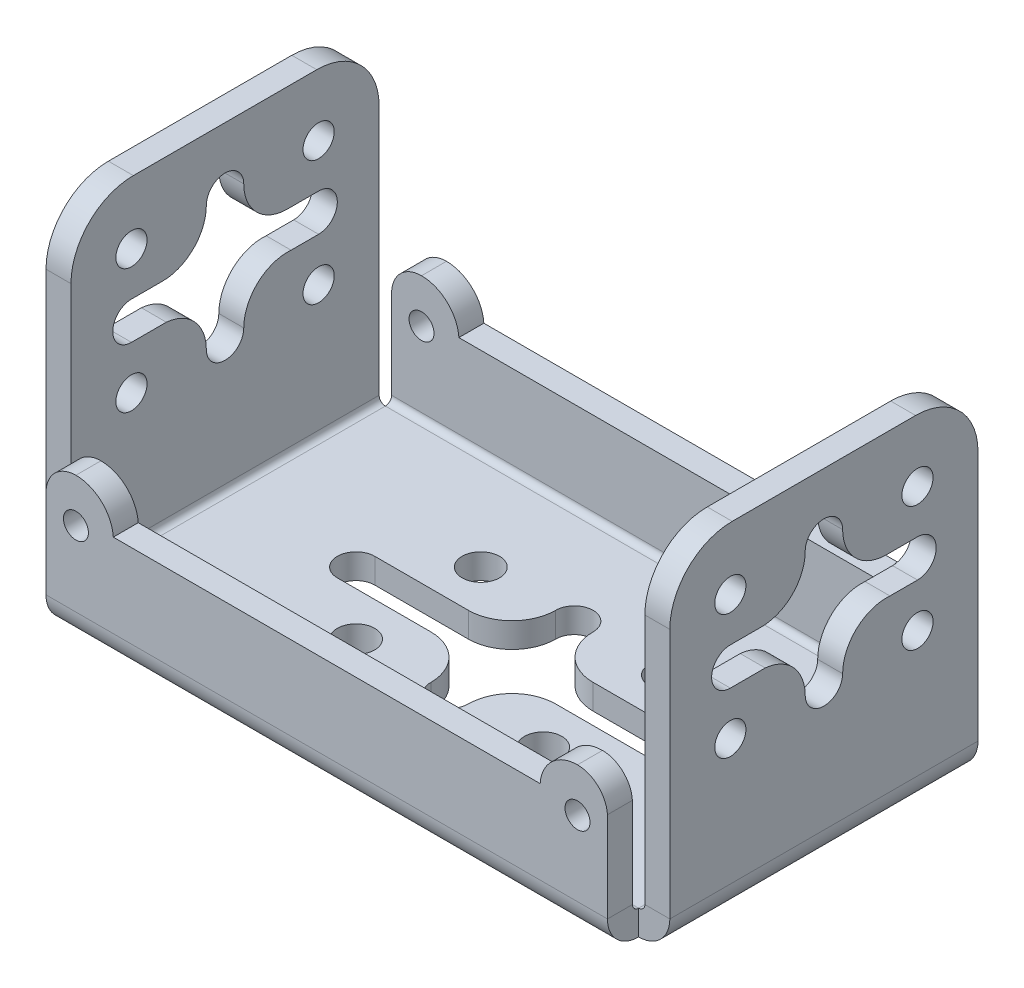
from build123d import *

# Parameters (mm, degrees)
CROQUIS2_W             = 45
CROQUIS2_H             = 24.7
BRIDA_BASE1_DEPTH      = 2
BRIDA_DE_ARISTA1_DEPTH = 24.7
BRIDA_DE_ARISTA2_DEPTH = 24.7
BRIDA_DE_ARISTA3_DEPTH = 45
BRIDA_DE_ARISTA4_DEPTH = 45
CROQUIS34_R            = 1.25
CORTAR_EXTRUIR2_DEPTH  = 59.102345047
REDONDEO2_R            = 5
CROQUIS35_R            = 1
CORTAR_EXTRUIR3_DEPTH  = 47.502150488
CROQUIS36_R            = 1.5
CORTAR_EXTRUIR4_DEPTH  = 10


# Sheet-metal steps are written as plain solids
with BuildPart() as part:
    # Croquis2 → Brida base1 (new body)
    with BuildSketch(Plane(origin=(0, 0, 0), x_dir=(1, 0, 0), z_dir=(0, 1, 0))):
        Rectangle(CROQUIS2_W, CROQUIS2_H)
    extrude(amount=-BRIDA_BASE1_DEPTH)

    # Brida de arista1 section (across the edge) → Brida de arista1 (add)
    with BuildSketch(Plane(origin=(23, 0, 12.35), x_dir=(-1, 0, 0), z_dir=(0, 0, -1))):
        with BuildLine():
            Line((-2, 0.5), (-2, 25.6))
            Line((-2, 25.6), (0, 25.6))
            Line((0, 25.6), (0, 0.5))
            ThreePointArc((0, 0.5), (0.146446609, 0.146446609), (0.5, 0))
            Line((0.5, 0), (0.5, -2))
            ThreePointArc((0.5, -2), (-1.267766953, -1.267766953), (-2, 0.5))
        make_face()
    extrude(amount=BRIDA_DE_ARISTA1_DEPTH)

    # Brida de arista2 section (across the edge) → Brida de arista2 (add)
    with BuildSketch(Plane(origin=(-23, 0, -12.35), x_dir=(1, 0, 0), z_dir=(0, 0, 1))):
        with BuildLine():
            Line((-2, 0.5), (-2, 25.6))
            Line((-2, 25.6), (0, 25.6))
            Line((0, 25.6), (0, 0.5))
            ThreePointArc((0, 0.5), (0.146446609, 0.146446609), (0.5, 0))
            Line((0.5, 0), (0.5, -2))
            ThreePointArc((0.5, -2), (-1.267766953, -1.267766953), (-2, 0.5))
        make_face()
    extrude(amount=BRIDA_DE_ARISTA2_DEPTH)

    # Brida de arista3 section (across the edge) → Brida de arista3 (add)
    with BuildSketch(Plane(origin=(22.5, 0, -12.85), x_dir=(0, 0, 1), z_dir=(-1, 0, 0))):
        with BuildLine():
            Line((-2, 0.5), (-2, 10))
            Line((-2, 10), (0, 10))
            Line((0, 10), (0, 0.5))
            ThreePointArc((0, 0.5), (0.146446609, 0.146446609), (0.5, 0))
            Line((0.5, 0), (0.5, -2))
            ThreePointArc((0.5, -2), (-1.267766953, -1.267766953), (-2, 0.5))
        make_face()
    extrude(amount=BRIDA_DE_ARISTA3_DEPTH)

    # Brida de arista4 section (across the edge) → Brida de arista4 (add)
    with BuildSketch(Plane(origin=(-22.5, 0, 12.85), x_dir=(0, 0, -1), z_dir=(1, 0, 0))):
        with BuildLine():
            Line((-2, 0.5), (-2, 10))
            Line((-2, 10), (0, 10))
            Line((0, 10), (0, 0.5))
            ThreePointArc((0, 0.5), (0.146446609, 0.146446609), (0.5, 0))
            Line((0.5, 0), (0.5, -2))
            ThreePointArc((0.5, -2), (-1.267766953, -1.267766953), (-2, 0.5))
        make_face()
    extrude(amount=BRIDA_DE_ARISTA4_DEPTH)

    # Croquis34 → Cortar-Extruir2 (cut, through all)
    with BuildSketch(Plane.ZY.offset(25)):
        with Locations(Location((-7.5, 20.6, 0), (0, 0, 270))):
            Circle(CROQUIS34_R)
        with Locations(Location((7.5, 20.6, 0), (0, 0, 270))):
            Circle(CROQUIS34_R)
        with Locations(Location((7.5, 10.6, 0), (0, 0, 270))):
            Circle(CROQUIS34_R)
        with Locations(Location((-7.5, 10.6, 0), (0, 0, 270))):
            Circle(CROQUIS34_R)
        with BuildLine():
            Line((-7.5, 17.1), (-5, 17.1))
            ThreePointArc((-5, 17.1), (-2.525126266, 18.125126266), (-1.5, 20.6))
            ThreePointArc((-1.5, 20.6), (0, 22.1), (1.5, 20.6))
            ThreePointArc((1.5, 20.6), (2.525126266, 18.125126266), (5, 17.1))
            Line((5, 17.1), (7.5, 17.1))
            ThreePointArc((7.5, 17.1), (9, 15.6), (7.5, 14.1))
            Line((7.5, 14.1), (4.704458788, 14.1))
            ThreePointArc((4.704458788, 14.1), (2.422114194, 12.972686037), (1.5, 10.6))
            ThreePointArc((1.5, 10.6), (0, 9.1), (-1.5, 10.6))
            ThreePointArc((-1.5, 10.6), (-2.631035123, 13.181478893), (-5.295541212, 14.1))
            Line((-5.295541212, 14.1), (-7.5, 14.1))
            ThreePointArc((-7.5, 14.1), (-9, 15.6), (-7.5, 17.1))
        make_face()
    extrude(amount=-CORTAR_EXTRUIR2_DEPTH, mode=Mode.SUBTRACT)

    # Redondeo2
    redondeo2_edges = [part.edges().sort_by_distance(p)[0] for p in [
        (24, 25.6, 12.35),
        (24, 25.6, -12.35),
        (-24, 25.6, -12.35),
        (-24, 25.6, 12.35),
    ]]
    fillet(redondeo2_edges, radius=REDONDEO2_R)

    # Croquis35 → Cortar-Extruir3 (cut, through all)
    with BuildSketch(Plane.XY.offset(14.85)):
        with BuildLine():
            ThreePointArc((-22.5, 7.6), (-21.797056275, 9.297056275), (-20.1, 10))
            Line((-20.1, 10), (-22.5, 10))
            Line((-22.5, 10), (-22.5, 7.6))
        make_face()
        with BuildLine():
            ThreePointArc((-20.1, 10), (-18.050609847, 9.19089023), (-17.106674091, 7.2))
            Line((-17.106674091, 7.2), (17.106674091, 7.2))
            ThreePointArc((17.106674091, 7.2), (18.050609847, 9.19089023), (20.1, 10))
            Line((20.1, 10), (-20.1, 10))
        make_face()
        with BuildLine():
            Line((22.5, 10), (20.1, 10))
            ThreePointArc((20.1, 10), (21.750190132, 9.344164297), (22.5, 7.734495665))
            Line((22.5, 7.734495665), (22.5, 10))
        make_face()
        with Locations((-20.1, 6.5)):
            Circle(CROQUIS35_R)
        with Locations((20.1, 6.5)):
            Circle(CROQUIS35_R)
    extrude(amount=-CORTAR_EXTRUIR3_DEPTH, mode=Mode.SUBTRACT)

    # Croquis36 → Cortar-Extruir4 (cut)
    with BuildSketch(Plane.XZ.offset(2)):
        with BuildLine():
            Line((-5, 1.5), (-12.5, 1.5))
            ThreePointArc((-12.5, 1.5), (-14, 0), (-12.5, -1.5))
            Line((-12.5, -1.5), (-5, -1.5))
            ThreePointArc((-5, -1.5), (-2.525126266, -2.525126266), (-1.5, -5))
            ThreePointArc((-1.5, -5), (0, -6.5), (1.5, -5))
            ThreePointArc((1.5, -5), (2.525126266, -2.525126266), (5, -1.5))
            Line((5, -1.5), (12.5, -1.5))
            ThreePointArc((12.5, -1.5), (14, 0), (12.5, 1.5))
            Line((12.5, 1.5), (5, 1.5))
            ThreePointArc((5, 1.5), (2.525126266, 2.525126266), (1.5, 5))
            ThreePointArc((1.5, 5), (0, 6.5), (-1.5, 5))
            ThreePointArc((-1.5, 5), (-2.525126266, 2.525126266), (-5, 1.5))
        make_face()
        with Locations(Location((-7.5, 5, 0), (0, 0, 270))):
            Circle(CROQUIS36_R)
        with Locations(Location((7.5, 5, 0), (0, 0, 270))):
            Circle(CROQUIS36_R)
        with Locations(Location((7.5, -5, 0), (0, 0, 270))):
            Circle(CROQUIS36_R)
        with Locations(Location((-7.5, -5, 0), (0, 0, 270))):
            Circle(CROQUIS36_R)
    extrude(amount=-CORTAR_EXTRUIR4_DEPTH, mode=Mode.SUBTRACT)


solid = part.part
